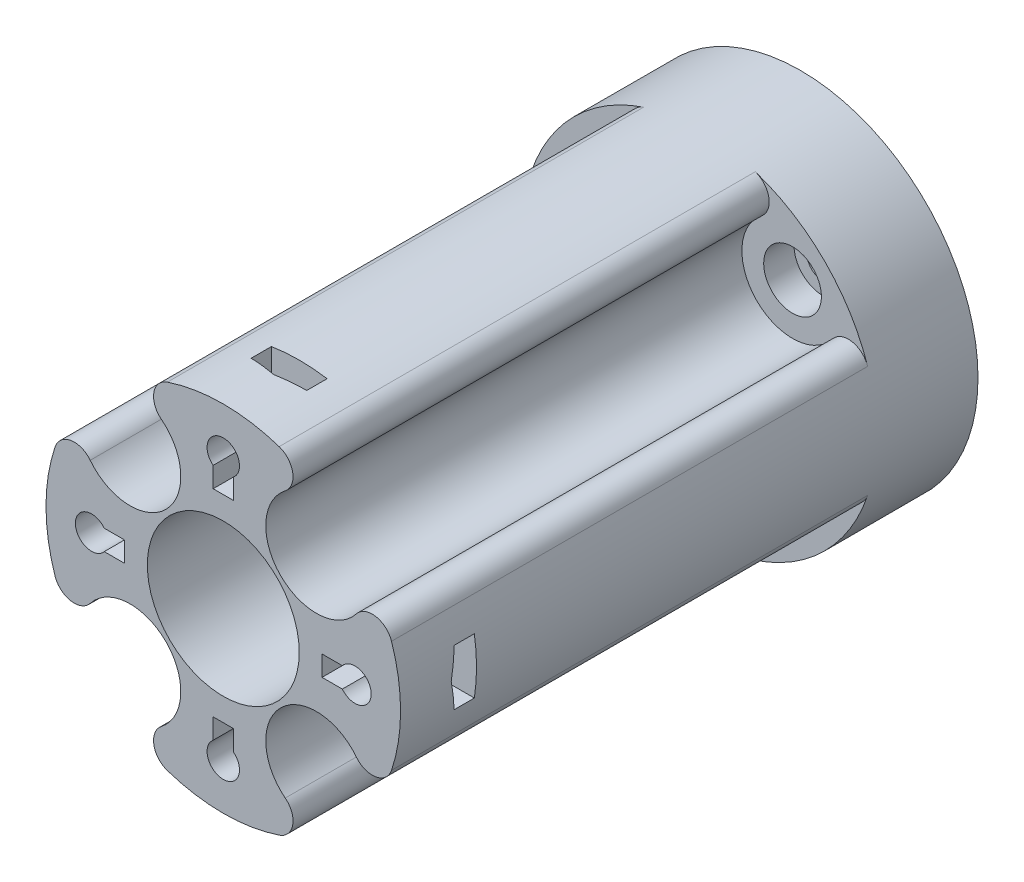
from build123d import *

# Parameters (mm, degrees)
SKETCH1_R           = 17.5
SKETCH1_R_2         = 2.85
SKETCH1_R_3         = 1.65
BOSS_EXTRUDE1_DEPTH = 57
SKETCH1_3_R         = 2.85
SKETCH1_3_R_2       = 1.6
BOSS_EXTRUDE2_DEPTH = 7
SKETCH2_R           = 5
CUT_EXTRUDE1_DEPTH  = 47
FILLET1_R           = 2
CUT_EXTRUDE2_START  = -7.5
SKETCH3_R           = 1.6
CUT_EXTRUDE2_DEPTH  = 2.5
CUT_EXTRUDE3_START  = -10
SKETCH3_2_R         = 1.6
CUT_EXTRUDE3_DEPTH  = 10
CHAMFER1_SIZE       = 2.75
CHAMFER1_SIZE_2     = 0.5
SKETCH4_R           = 7.5
CUT_EXTRUDE4_DEPTH  = 63.140968921
SKETCH1_4_R         = 1.65
CUT_EXTRUDE5_DEPTH  = 3
CUT_EXTRUDE6_REACH  = 64.141
SKETCH5_W           = 2
SKETCH5_H           = 3.25
SKETCH5_W_2         = 3.25
SKETCH5_H_2         = 2


with BuildPart() as part:
    # Sketch1 → Boss-Extrude1 (new body)
    # profile 1 of 5: a face of its own
    with BuildSketch(Plane(origin=(0, 0, 0), x_dir=(0, 1, 0), z_dir=(0, 0, 1))):
        with Locations(Location((0, 0, 0), (0, 0, 90))):
            Circle(SKETCH1_R)
        with Locations(Location((-9.192388155, 9.192388155, 0), (0, 0, 90))):
            Circle(SKETCH1_R_2, mode=Mode.SUBTRACT)
        with Locations(Location((-9.192388155, -9.192388155, 0), (0, 0, 90))):
            Circle(SKETCH1_R_2, mode=Mode.SUBTRACT)
        with Locations(Location((9.192388155, -9.192388155, 0), (0, 0, 90))):
            Circle(SKETCH1_R_2, mode=Mode.SUBTRACT)
        with Locations(Location((9.192388155, 9.192388155, 0), (0, 0, 90))):
            Circle(SKETCH1_R_2, mode=Mode.SUBTRACT)
    # profile 2 of 5: a face of its own
    with BuildSketch(Plane(origin=(0, 0, 0), x_dir=(0, 1, 0), z_dir=(0, 0, 1))):
        with Locations((0, 13)):
            Circle(SKETCH1_R_3)
    # profile 3 of 5: a face of its own
    with BuildSketch(Plane(origin=(0, 0, 0), x_dir=(0, 1, 0), z_dir=(0, 0, 1))):
        with Locations((-13, 0)):
            Circle(SKETCH1_R_3)
    # profile 4 of 5: a face of its own
    with BuildSketch(Plane(origin=(0, 0, 0), x_dir=(0, 1, 0), z_dir=(0, 0, 1))):
        with Locations((0, -13)):
            Circle(SKETCH1_R_3)
    # profile 5 of 5: a face of its own
    with BuildSketch(Plane(origin=(0, 0, 0), x_dir=(0, 1, 0), z_dir=(0, 0, 1))):
        with Locations((13, 0)):
            Circle(SKETCH1_R_3)
    extrude(amount=BOSS_EXTRUDE1_DEPTH)

    # Sketch1<3> → Boss-Extrude2 (add)
    # profile 1 of 4: a face of its own
    with BuildSketch(Plane(origin=(0, 0, 0), x_dir=(0, 1, 0), z_dir=(0, 0, 1))):
        with Locations(Location((-9.192388155, -9.192388155, 0), (0, 0, 90))):
            Circle(SKETCH1_3_R)
        with Locations(Location((-9.192388155, -9.192388155, 0), (0, 0, 270))):
            Circle(SKETCH1_3_R_2, mode=Mode.SUBTRACT)
    # profile 2 of 4: a face of its own
    with BuildSketch(Plane(origin=(0, 0, 0), x_dir=(0, 1, 0), z_dir=(0, 0, 1))):
        with Locations(Location((-9.192388155, 9.192388155, 0), (0, 0, 90))):
            Circle(SKETCH1_3_R)
        with Locations(Location((-9.192388155, 9.192388155, 0), (0, 0, 270))):
            Circle(SKETCH1_3_R_2, mode=Mode.SUBTRACT)
    # profile 3 of 4: a face of its own
    with BuildSketch(Plane(origin=(0, 0, 0), x_dir=(0, 1, 0), z_dir=(0, 0, 1))):
        with Locations(Location((9.192388155, -9.192388155, 0), (0, 0, 90))):
            Circle(SKETCH1_3_R)
        with Locations(Location((9.192388155, -9.192388155, 0), (0, 0, 270))):
            Circle(SKETCH1_3_R_2, mode=Mode.SUBTRACT)
    # profile 4 of 4: a face of its own
    with BuildSketch(Plane(origin=(0, 0, 0), x_dir=(0, 1, 0), z_dir=(0, 0, 1))):
        with Locations(Location((9.192388155, 9.192388155, 0), (0, 0, 90))):
            Circle(SKETCH1_3_R)
        with Locations(Location((9.192388155, 9.192388155, 0), (0, 0, 270))):
            Circle(SKETCH1_3_R_2, mode=Mode.SUBTRACT)
    extrude(amount=BOSS_EXTRUDE2_DEPTH)

    # Sketch2 → Cut-Extrude1 (cut)
    with BuildSketch(Plane.XY.offset(57)):
        with Locations((-9.192388155, 9.192388155)):
            Circle(SKETCH2_R)
        with Locations((9.192388155, 9.192388155)):
            Circle(SKETCH2_R)
        with Locations((9.192388155, -9.192388155)):
            Circle(SKETCH2_R)
        with Locations((-9.192388155, -9.192388155)):
            Circle(SKETCH2_R)
    extrude(amount=-CUT_EXTRUDE1_DEPTH, mode=Mode.SUBTRACT)

    # Fillet1
    fillet1_edges = [part.edges().sort_by_distance(p)[0] for p in [
        (-14.028560913, -10.46181049, 33.5),
        (-10.46181049, -14.028560913, 33.5),
        (10.46181049, -14.028560913, 33.5),
        (14.028560913, -10.46181049, 33.5),
        (14.028560913, 10.46181049, 33.5),
        (10.46181049, 14.028560913, 33.5),
        (-10.46181049, 14.028560913, 33.5),
        (-14.028560913, 10.46181049, 33.5),
    ]]
    fillet(fillet1_edges, radius=FILLET1_R)

    # Sketch3 → Cut-Extrude2 (cut)
    # profile 1 of 4: a face of its own
    with BuildSketch(Plane.XY.offset(57).offset(CUT_EXTRUDE2_START)):
        with BuildLine():
            Line((-2.75, 15.75), (-2.75, 17.282577933))
            ThreePointArc((-2.75, 17.282577933), (0, 17.5), (2.75, 17.282577933))
            Line((2.75, 17.282577933), (2.75, 15.75))
            Line((2.75, 15.75), (2.75, 10.25))
            Line((2.75, 10.25), (-2.75, 10.25))
            Line((-2.75, 10.25), (-2.75, 15.75))
        make_face()
        with Locations((0, 13)):
            Circle(SKETCH3_R, mode=Mode.SUBTRACT)
    # profile 2 of 4: a face of its own
    with BuildSketch(Plane.XY.offset(57).offset(CUT_EXTRUDE2_START)):
        with BuildLine():
            Line((15.75, -2.75), (10.25, -2.75))
            Line((10.25, -2.75), (10.25, 2.75))
            Line((10.25, 2.75), (15.75, 2.75))
            Line((15.75, 2.75), (17.282577933, 2.75))
            ThreePointArc((17.282577933, 2.75), (17.5, 0), (17.282577933, -2.75))
            Line((17.282577933, -2.75), (15.75, -2.75))
        make_face()
        with Locations((13, 0)):
            Circle(SKETCH3_R, mode=Mode.SUBTRACT)
    # profile 3 of 4: a face of its own
    with BuildSketch(Plane.XY.offset(57).offset(CUT_EXTRUDE2_START)):
        with BuildLine():
            Line((-2.75, -15.75), (-2.75, -10.25))
            Line((-2.75, -10.25), (2.75, -10.25))
            Line((2.75, -10.25), (2.75, -15.75))
            Line((2.75, -15.75), (2.75, -17.282577933))
            ThreePointArc((2.75, -17.282577933), (0, -17.5), (-2.75, -17.282577933))
            Line((-2.75, -17.282577933), (-2.75, -15.75))
        make_face()
        with Locations((0, -13)):
            Circle(SKETCH3_R, mode=Mode.SUBTRACT)
    # profile 4 of 4: a face of its own
    with BuildSketch(Plane.XY.offset(57).offset(CUT_EXTRUDE2_START)):
        with BuildLine():
            Line((-15.75, 2.75), (-10.25, 2.75))
            Line((-10.25, 2.75), (-10.25, -2.75))
            Line((-10.25, -2.75), (-15.75, -2.75))
            Line((-15.75, -2.75), (-17.282577933, -2.75))
            ThreePointArc((-17.282577933, -2.75), (-17.5, 0), (-17.282577933, 2.75))
            Line((-17.282577933, 2.75), (-15.75, 2.75))
        make_face()
        with Locations((-13, 0)):
            Circle(SKETCH3_R, mode=Mode.SUBTRACT)
    extrude(amount=CUT_EXTRUDE2_DEPTH, mode=Mode.SUBTRACT)

    # Sketch3<2> → Cut-Extrude3 (cut)
    with BuildSketch(Plane.XY.offset(57).offset(CUT_EXTRUDE3_START)):
        with Locations((-13, 0)):
            Circle(SKETCH3_2_R)
        with Locations((0, 13)):
            Circle(SKETCH3_2_R)
        with Locations((13, 0)):
            Circle(SKETCH3_2_R)
        with Locations((0, -13)):
            Circle(SKETCH3_2_R)
    extrude(amount=CUT_EXTRUDE3_DEPTH, mode=Mode.SUBTRACT)

    # Chamfer1
    # the kernel refuses this chamfer: 2.75, 0.5 mm, written as the material it adds along each edge
    with BuildSketch(Plane(origin=(-3.104266441, -2.75, 52), x_dir=(1.0355932807417332e-14, 0.9999763028084744, 0.006884317068104265), z_dir=(-1, 0, 0))) as chamfer1_piece_1_section:
        Polygon((CHAMFER1_SIZE * 0.999976302808, CHAMFER1_SIZE * 0.0068843170681), (-CHAMFER1_SIZE_2 * 0.0068843170681, CHAMFER1_SIZE_2 * 0.999976302808), (0, 0), align=None)
    chamfer1_piece_1 = extrude(amount=21.324045051, mode=Mode.PRIVATE)
    chamfer1_piece_1 = chamfer1_piece_1 & Plane(origin=(0, 0, 51.863927103), x_dir=(-1, 0, 0), z_dir=(0, 0, -1)) * Cylinder(17.5, 54, mode=Mode.PRIVATE)
    chamfer1_piece_1 = chamfer1_piece_1 - Plane(origin=(-13, 0, 51.863927103), x_dir=(1, 0, 0), z_dir=(0, 0, -1)) * Cylinder(1.6, 54, mode=Mode.PRIVATE)
    add(chamfer1_piece_1)
    with BuildSketch(Plane(origin=(-24.428311492, 2.75, 52), x_dir=(-1.048222467092242e-14, -0.9999763028084744, 0.006884317068104265), z_dir=(1, 0, 0))) as chamfer1_piece_2_section:
        Polygon((CHAMFER1_SIZE * 0.999976302808, CHAMFER1_SIZE * 0.0068843170681), (-CHAMFER1_SIZE_2 * 0.0068843170681, CHAMFER1_SIZE_2 * 0.999976302808), (0, 0), align=None)
    chamfer1_piece_2 = extrude(amount=21.324045051, mode=Mode.PRIVATE)
    chamfer1_piece_2 = chamfer1_piece_2 & Plane(origin=(0, 0, 51.852070579), x_dir=(-1, 0, 0), z_dir=(0, 0, -1)) * Cylinder(17.5, 54, mode=Mode.PRIVATE)
    chamfer1_piece_2 = chamfer1_piece_2 - Plane(origin=(-13, 0, 51.852070579), x_dir=(1, 0, 0), z_dir=(0, 0, -1)) * Cylinder(1.6, 54, mode=Mode.PRIVATE)
    add(chamfer1_piece_2)
    with BuildSketch(Plane(origin=(-2.75, 3.104266441, 52), x_dir=(0.9999763028084744, 0, 0.006884317068104265), z_dir=(0, 1, 0))) as chamfer1_piece_3_section:
        Polygon((CHAMFER1_SIZE * 0.999976302808, CHAMFER1_SIZE * 0.0068843170681), (-CHAMFER1_SIZE_2 * 0.0068843170681, CHAMFER1_SIZE_2 * 0.999976302808), (0, 0), align=None)
    chamfer1_piece_3 = extrude(amount=21.324045051, mode=Mode.PRIVATE)
    chamfer1_piece_3 = chamfer1_piece_3 & Plane(origin=(0, 0, 51.863927103), x_dir=(-1, 0, 0), z_dir=(0, 0, -1)) * Cylinder(17.5, 54, mode=Mode.PRIVATE)
    chamfer1_piece_3 = chamfer1_piece_3 - Plane(origin=(0, 13, 51.863927103), x_dir=(1, 0, 0), z_dir=(0, 0, -1)) * Cylinder(1.6, 54, mode=Mode.PRIVATE)
    add(chamfer1_piece_3)
    with BuildSketch(Plane(origin=(2.75, 24.428311492, 52), x_dir=(0.20388124945923355, 0, -0.9789956262001082), z_dir=(0, -1, 0))) as chamfer1_piece_4_section:
        Polygon((CHAMFER1_SIZE_2 * 0.9789956262, -CHAMFER1_SIZE_2 * 0.203881249459), (-CHAMFER1_SIZE * 0.203881249459, -CHAMFER1_SIZE * 0.9789956262), (0, 0), align=None)
    chamfer1_piece_4 = extrude(amount=21.324045051, mode=Mode.PRIVATE)
    chamfer1_piece_4 = chamfer1_piece_4 & Plane(origin=(0, 0, 51.852070749), x_dir=(-1, 0, 0), z_dir=(0, 0, -1)) * Cylinder(17.5, 54, mode=Mode.PRIVATE)
    chamfer1_piece_4 = chamfer1_piece_4 - Plane(origin=(0, 13, 51.852070749), x_dir=(1, 0, 0), z_dir=(0, 0, -1)) * Cylinder(1.6, 54, mode=Mode.PRIVATE)
    add(chamfer1_piece_4)
    with BuildSketch(Plane(origin=(3.104266441, 2.75, 52), x_dir=(-3.409880314637416e-15, -0.9999763028084744, 0.006884317068104265), z_dir=(1, 0, 0))) as chamfer1_piece_5_section:
        Polygon((CHAMFER1_SIZE * 0.999976302808, CHAMFER1_SIZE * 0.0068843170681), (-CHAMFER1_SIZE_2 * 0.0068843170681, CHAMFER1_SIZE_2 * 0.999976302808), (0, 0), align=None)
    chamfer1_piece_5 = extrude(amount=21.324045051, mode=Mode.PRIVATE)
    chamfer1_piece_5 = chamfer1_piece_5 & Plane(origin=(0, 0, 51.863927103), x_dir=(-1, 0, 0), z_dir=(0, 0, -1)) * Cylinder(17.5, 54, mode=Mode.PRIVATE)
    chamfer1_piece_5 = chamfer1_piece_5 - Plane(origin=(13, 0, 51.863927103), x_dir=(1, 0, 0), z_dir=(0, 0, -1)) * Cylinder(1.6, 54, mode=Mode.PRIVATE)
    add(chamfer1_piece_5)
    with BuildSketch(Plane(origin=(24.428311492, -2.75, 52), x_dir=(0, -0.20388124945923355, -0.9789956262001082), z_dir=(-1, 0, 0))) as chamfer1_piece_6_section:
        Polygon((CHAMFER1_SIZE_2 * 0.9789956262, -CHAMFER1_SIZE_2 * 0.203881249459), (-CHAMFER1_SIZE * 0.203881249459, -CHAMFER1_SIZE * 0.9789956262), (0, 0), align=None)
    chamfer1_piece_6 = extrude(amount=21.324045051, mode=Mode.PRIVATE)
    chamfer1_piece_6 = chamfer1_piece_6 & Plane(origin=(0, 0, 51.852070888), x_dir=(-1, 0, 0), z_dir=(0, 0, -1)) * Cylinder(17.5, 54, mode=Mode.PRIVATE)
    chamfer1_piece_6 = chamfer1_piece_6 - Plane(origin=(13, 0, 51.852070888), x_dir=(1, 0, 0), z_dir=(0, 0, -1)) * Cylinder(1.6, 54, mode=Mode.PRIVATE)
    add(chamfer1_piece_6)
    with BuildSketch(Plane(origin=(2.75, -3.104266441, 52), x_dir=(-0.9999763028084744, 6.88290656102737e-15, 0.006884317068104265), z_dir=(0, -1, 0))) as chamfer1_piece_7_section:
        Polygon((CHAMFER1_SIZE * 0.999976302808, CHAMFER1_SIZE * 0.0068843170681), (-CHAMFER1_SIZE_2 * 0.0068843170681, CHAMFER1_SIZE_2 * 0.999976302808), (0, 0), align=None)
    chamfer1_piece_7 = extrude(amount=21.324045051, mode=Mode.PRIVATE)
    chamfer1_piece_7 = chamfer1_piece_7 & Plane(origin=(0, 0, 51.863927103), x_dir=(-1, 0, 0), z_dir=(0, 0, -1)) * Cylinder(17.5, 54, mode=Mode.PRIVATE)
    chamfer1_piece_7 = chamfer1_piece_7 - Plane(origin=(0, -13, 51.863927103), x_dir=(1, 0, 0), z_dir=(0, 0, -1)) * Cylinder(1.6, 54, mode=Mode.PRIVATE)
    add(chamfer1_piece_7)
    with BuildSketch(Plane(origin=(-2.75, -24.428311492, 52), x_dir=(-0.20388124945923355, 1.4290779976363847e-15, -0.9789956262001082), z_dir=(0, 1, 0))) as chamfer1_piece_8_section:
        Polygon((CHAMFER1_SIZE_2 * 0.9789956262, -CHAMFER1_SIZE_2 * 0.203881249459), (-CHAMFER1_SIZE * 0.203881249459, -CHAMFER1_SIZE * 0.9789956262), (0, 0), align=None)
    chamfer1_piece_8 = extrude(amount=21.324045051, mode=Mode.PRIVATE)
    chamfer1_piece_8 = chamfer1_piece_8 & Plane(origin=(0, 0, 51.852070422), x_dir=(-1, 0, 0), z_dir=(0, 0, -1)) * Cylinder(17.5, 54, mode=Mode.PRIVATE)
    chamfer1_piece_8 = chamfer1_piece_8 - Plane(origin=(0, -13, 51.852070422), x_dir=(1, 0, 0), z_dir=(0, 0, -1)) * Cylinder(1.6, 54, mode=Mode.PRIVATE)
    add(chamfer1_piece_8)

    # Sketch4 → Cut-Extrude4 (cut, through all)
    with BuildSketch(Plane.XY.offset(57)):
        Circle(SKETCH4_R)
    extrude(amount=-CUT_EXTRUDE4_DEPTH, mode=Mode.SUBTRACT)

    # Sketch1<4> → Cut-Extrude5 (cut)
    with BuildSketch(Plane(origin=(0, 0, 0), x_dir=(0, 1, 0), z_dir=(0, 0, 1))):
        with Locations(Location((-13, 0, 0), (0, 0, 270))):
            Circle(SKETCH1_4_R)
        with Locations(Location((0, -13, 0), (0, 0, 270))):
            Circle(SKETCH1_4_R)
        with Locations(Location((13, 0, 0), (0, 0, 270))):
            Circle(SKETCH1_4_R)
        with Locations(Location((0, 13, 0), (0, 0, 270))):
            Circle(SKETCH1_4_R)
    extrude(amount=CUT_EXTRUDE5_DEPTH, mode=Mode.SUBTRACT)

    # Cut-Extrude6: up to this face of the body (flat: up to its plane)
    cut_extrude6_end = Plane(part.part.faces().sort_by_distance((-2.658998626, -13.766288966, 49.5))[0])
    # Sketch5 → Cut-Extrude6 (cut, up to the picked face)
    with BuildSketch(Plane.XY.offset(57), mode=Mode.PRIVATE) as cut_extrude6_sk1:
        with Locations((0, 11.375)):
            Rectangle(SKETCH5_W, SKETCH5_H)
    cut_extrude6_tool1 = split(extrude(cut_extrude6_sk1.sketch, amount=-CUT_EXTRUDE6_REACH, mode=Mode.PRIVATE), bisect_by=cut_extrude6_end, keep=Keep.BOTH, mode=Mode.PRIVATE)
    # Sketch5 → Cut-Extrude6 (cut, up to the picked face)
    with BuildSketch(Plane.XY.offset(57), mode=Mode.PRIVATE) as cut_extrude6_sk2:
        with Locations((11.375, 0)):
            Rectangle(SKETCH5_W_2, SKETCH5_H_2)
    cut_extrude6_tool2 = split(extrude(cut_extrude6_sk2.sketch, amount=-CUT_EXTRUDE6_REACH, mode=Mode.PRIVATE), bisect_by=cut_extrude6_end, keep=Keep.BOTH, mode=Mode.PRIVATE)
    # Sketch5 → Cut-Extrude6 (cut, up to the picked face)
    with BuildSketch(Plane.XY.offset(57), mode=Mode.PRIVATE) as cut_extrude6_sk3:
        with Locations((0, -11.375)):
            Rectangle(SKETCH5_W, SKETCH5_H)
    cut_extrude6_tool3 = split(extrude(cut_extrude6_sk3.sketch, amount=-CUT_EXTRUDE6_REACH, mode=Mode.PRIVATE), bisect_by=cut_extrude6_end, keep=Keep.BOTH, mode=Mode.PRIVATE)
    # Sketch5 → Cut-Extrude6 (cut, up to the picked face)
    with BuildSketch(Plane.XY.offset(57), mode=Mode.PRIVATE) as cut_extrude6_sk4:
        with Locations((-11.375, 0)):
            Rectangle(SKETCH5_W_2, SKETCH5_H_2)
    cut_extrude6_tool4 = split(extrude(cut_extrude6_sk4.sketch, amount=-CUT_EXTRUDE6_REACH, mode=Mode.PRIVATE), bisect_by=cut_extrude6_end, keep=Keep.BOTH, mode=Mode.PRIVATE)
    add(cut_extrude6_tool1.solids().sort_by(Axis((0, 11.375, 57), (0, 0, -1)))[0], mode=Mode.SUBTRACT)
    add(cut_extrude6_tool2.solids().sort_by(Axis((11.375, 0, 57), (0, 0, -1)))[0], mode=Mode.SUBTRACT)
    add(cut_extrude6_tool3.solids().sort_by(Axis((0, -11.375, 57), (0, 0, -1)))[0], mode=Mode.SUBTRACT)
    add(cut_extrude6_tool4.solids().sort_by(Axis((-11.375, 0, 57), (0, 0, -1)))[0], mode=Mode.SUBTRACT)


solid = part.part
